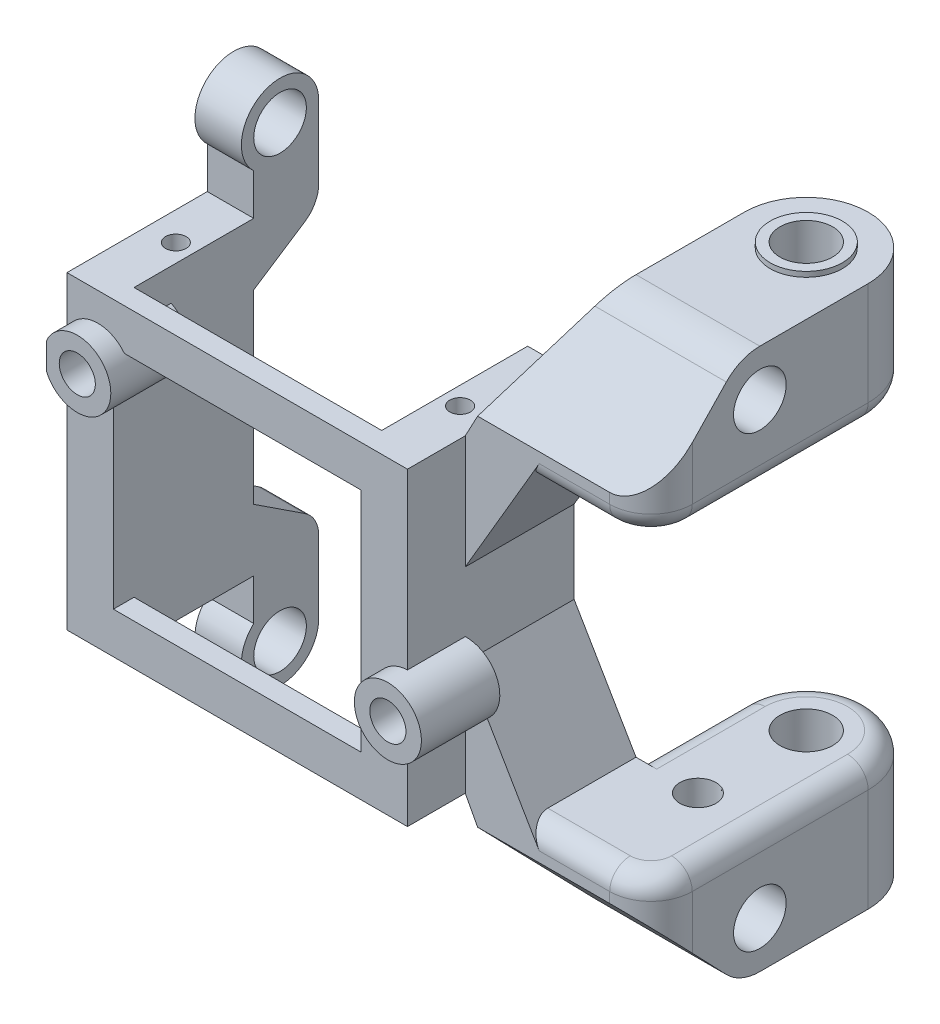
from build123d import *
from build123d.topology import SkipClean

# Parameters (mm, degrees)
BOSS_EXTRUDE1_DEPTH       = 12
BOSS_EXTRUDE2_DEPTH       = 8
BOSS_EXTRUDE3_START       = 11.25
SKETCH1_10_W              = 4.5
SKETCH1_10_H              = 13.6
SKETCH1_10_R              = 1
BOSS_EXTRUDE3_DEPTH       = 15
BOSS_EXTRUDE6_START       = 11.25
SKETCH1_14_W              = 24
SKETCH1_14_H              = 2
BOSS_EXTRUDE6_DEPTH       = 4
SKETCH3_R                 = 2.55
BOSS_EXTRUDE8_DEPTH       = 18
CUT_EXTRUDE2_DEPTH        = 18
BOSS_EXTRUDE12_DEPTH      = 2
BOSS_EXTRUDE12_DEPTH_BACK = 5.6
SKETCH4_R                 = 3.25
SKETCH4_R_2               = 1.75
SKETCH4_5_R               = 1.75
CUT_EXTRUDE3_DEPTH        = 4
SKETCH5_R                 = 3.75
SKETCH5_R_2               = 2.55
BOSS_EXTRUDE13_DEPTH      = 4.5
BOSS_EXTRUDE15_DEPTH      = 2.55
BOSS_EXTRUDE16_START      = -9
BOSS_EXTRUDE16_OUTLINE_R  = 2.55
BOSS_EXTRUDE16_DEPTH      = 52.5
CUT_EXTRUDE8_DEPTH        = 73.764500273
SKETCH3_4_R               = 2.55
CUT_EXTRUDE9_DEPTH        = 43.5
SKETCH11_R                = 3.5
SKETCH11_R_2              = 2.55
BOSS_EXTRUDE17_DEPTH      = 0.5
CUT_EXTRUDE10_DEPTH       = 67.553005191
CUT_EXTRUDE11_START       = -5.645461068
CUT_EXTRUDE11_DEPTH       = 39.790737469
FILLET1_R                 = 2


# Read off the part's stored shape, not the designer's step: Boss-Extrude16, Cut-Extrude11
with BuildPart() as part:
    # Sketch1 → Boss-Extrude1 (new body)
    with BuildSketch(Plane(origin=(0, 0, 0), x_dir=(1, 0, 0), z_dir=(0, 1, 0))):
        with BuildLine():
            Line((-4, -4), (0, -4))
            ThreePointArc((0, -4), (2.828427125, -2.828427125), (4, 0))
            Line((4, 0), (4, 4))
            Line((4, 4), (-4, 4))
            Line((-4, 4), (-4, -4))
        make_face()
    extrude(amount=BOSS_EXTRUDE1_DEPTH)

    # Sketch2 → Boss-Extrude2 (add)
    with BuildSketch(Plane.XY.offset(4)):
        Polygon((-14, 11.25), (-8, 0), (-4, 0), (-4, 12), (-8, 12), (-14, 22.25), align=None)
    extrude(amount=-BOSS_EXTRUDE2_DEPTH)

    # Sketch1<10> → Boss-Extrude3 (add)
    # profile 1 of 2: a face of its own
    with BuildSketch(Plane(origin=(0, 0, 0), x_dir=(1, 0, 0), z_dir=(0, 1, 0)).offset(BOSS_EXTRUDE3_START)):
        with Locations((-16.25, -2.8)):
            Rectangle(SKETCH1_10_W, SKETCH1_10_H)
        with Locations(Location((-16.75, -1.75, 0), (0, 0, 270))):
            Circle(SKETCH1_10_R, mode=Mode.SUBTRACT)
    # profile 2 of 2: a face of its own
    with BuildSketch(Plane(origin=(0, 0, 0), x_dir=(1, 0, 0), z_dir=(0, 1, 0)).offset(BOSS_EXTRUDE3_START)):
        with Locations((-44.75, -2.8)):
            Rectangle(SKETCH1_10_W, SKETCH1_10_H)
        with Locations(Location((-44.249954545, -1.8, 0), (0, 0, 270))):
            Circle(SKETCH1_10_R, mode=Mode.SUBTRACT)
    extrude(amount=BOSS_EXTRUDE3_DEPTH)


with BuildPart() as boss_extrude3_piece_1:
    # of the separate pieces the step leaves, piece 1, a body of its own (boss_extrude3_pieces)
    add(part.part.solids().sort_by_distance((0, 0, 4))[0])



with BuildPart() as boss_extrude3_piece_2:
    # of the separate pieces the step leaves, piece 2, a body of its own (boss_extrude3_pieces)
    add(part.part.solids().sort_by_distance((-42.5, 11.25, 9.6))[0])


with BuildPart() as boss_extrude3_piece_1_1:
    add(boss_extrude3_piece_1.part)

    add(boss_extrude3_piece_2.part)  # Boss-Extrude6 merges Boss-Extrude3 piece 2
    # Sketch1<14> → Boss-Extrude6 (add)
    with BuildSketch(Plane(origin=(0, 0, 0), x_dir=(1, 0, 0), z_dir=(0, 1, 0)).offset(BOSS_EXTRUDE6_START)):
        with Locations((-30.5, -8.6)):
            Rectangle(SKETCH1_14_W, SKETCH1_14_H)
    extrude(amount=BOSS_EXTRUDE6_DEPTH)

    # Sketch3 → Boss-Extrude8 (add)
    with BuildSketch(Plane(origin=(-14, 0, 0), x_dir=(0, 0, -1), z_dir=(1, 0, 0))):
        with BuildLine():
            Line((6.55, 9), (3.5, 9))
            Line((3.5, 9), (3.5, 1.191299349))
            ThreePointArc((3.5, 1.191299349), (10.741607862, 2.862800093), (6.55, 9))
        make_face()
        with Locations((6.55, 4.5)):
            Circle(SKETCH3_R, mode=Mode.SUBTRACT)
    extrude(amount=BOSS_EXTRUDE8_DEPTH)

    # Sketch2<5> → Cut-Extrude2 (cut)
    with BuildSketch(Plane.XY.offset(4)):
        Polygon((-14, 11.25), (-14, 0), (-8, 0), align=None)
    extrude(amount=-CUT_EXTRUDE2_DEPTH, mode=Mode.SUBTRACT)

    # Mirror1: Boss-Extrude3 piece 1 across plane


with BuildPart() as boss_extrude3_piece_1_2:
    add(boss_extrude3_piece_1_1.part)
    add(boss_extrude3_piece_1_1.part.mirror(Plane(origin=(0, 26.25, 0), x_dir=(0, 0, 1), z_dir=(0, -1, 0))))

    # Sketch4 → Boss-Extrude12 (add, two sides: drawn at the far end of the back side and taken through both)
    # profile 1 of 2: a face of its own
    with BuildSketch(Plane.XY.offset(9.6).offset(-BOSS_EXTRUDE12_DEPTH_BACK)):
        with Locations(Location((-13.9, 21.15, 0), (0, 0, 268.236774642))):
            Circle(SKETCH4_R)
        with Locations(Location((-13.9, 21.15, 0), (0, 0, 93.27582896))):
            Circle(SKETCH4_R_2, mode=Mode.SUBTRACT)
    # profile 2 of 2: a face of its own
    with BuildSketch(Plane.XY.offset(9.6).offset(-BOSS_EXTRUDE12_DEPTH_BACK)):
        with BuildLine():
            Line((-47, 36.5), (-47, 34))
            ThreePointArc((-47, 34), (-40.75, 35.25), (-47, 36.5))
        make_face()
        with Locations(Location((-44, 35.25, 0), (0, 0, 328.997280866))):
            Circle(SKETCH4_R_2, mode=Mode.SUBTRACT)
    extrude(amount=BOSS_EXTRUDE12_DEPTH + BOSS_EXTRUDE12_DEPTH_BACK)

    # Sketch4<5> → Cut-Extrude3 (cut)
    with BuildSketch(Plane.XY.offset(9.6)):
        with Locations(Location((-44, 35.25, 0), (0, 0, 328.997280866))):
            Circle(SKETCH4_5_R)
        with BuildLine():
            ThreePointArc((-14, 19.402859479), (-12.698438516, 19.877698935), (-12.15, 21.15))
            ThreePointArc((-12.15, 21.15), (-12.698438516, 22.422301065), (-14, 22.897140521))
            Line((-14, 22.897140521), (-14, 19.402859479))
        make_face()
        with BuildLine():
            Line((-14, 19.402859479), (-14, 22.897140521))
            ThreePointArc((-14, 22.897140521), (-15.65, 21.15), (-14, 19.402859479))
        make_face()
    extrude(amount=-CUT_EXTRUDE3_DEPTH, mode=Mode.SUBTRACT)

    # Sketch5 → Boss-Extrude13 (add)
    # profile 1 of 4: a face of its own
    with BuildSketch(Plane.ZY.offset(47)):
        with Locations((-6.55, 4.5)):
            Circle(SKETCH5_R)
        with Locations(Location((-6.55, 4.5, 0), (0, 0, 90))):
            Circle(SKETCH5_R_2, mode=Mode.SUBTRACT)
    # profile 2 of 4: a face of its own
    with BuildSketch(Plane.ZY.offset(47)):
        with BuildLine():
            Line((-4, 11.25), (-4, 17.25))
            Line((-4, 17.25), (-8.944573185, 14.009059393))
            ThreePointArc((-8.944573185, 14.009059393), (-9.939480967, 12.925882261), (-10.3, 11.5))
            Line((-10.3, 11.5), (-10.3, 4.5))
            ThreePointArc((-10.3, 4.5), (-8.05, 7.936931771), (-4, 7.249545417))
            Line((-4, 7.249545417), (-4, 11.25))
        make_face()
    # profile 3 of 4: a face of its own
    with BuildSketch(Plane.ZY.offset(47)):
        with BuildLine():
            Line((-4, 35.25), (-4, 41.25))
            Line((-4, 41.25), (-4, 45.250454583))
            ThreePointArc((-4, 45.250454583), (-8.05, 44.563068229), (-10.3, 48))
            Line((-10.3, 48), (-10.3, 41))
            ThreePointArc((-10.3, 41), (-9.939480967, 39.574117739), (-8.944573185, 38.490940607))
            Line((-8.944573185, 38.490940607), (-4, 35.25))
        make_face()
    # profile 4 of 4: a face of its own
    with BuildSketch(Plane.ZY.offset(47)):
        with Locations((-6.55, 48)):
            Circle(SKETCH5_R)
        with Locations(Location((-6.55, 48, 0), (0, 0, 270))):
            Circle(SKETCH5_R_2, mode=Mode.SUBTRACT)
    extrude(amount=-BOSS_EXTRUDE13_DEPTH)

    # Sketch9 → Boss-Extrude15 (add)
    with BuildSketch(Plane(origin=(0, 0, -4), x_dir=(-1, 0, 0), z_dir=(0, 0, -1))):
        Polygon((-4, 12), (-4, 9), (12.8, 9), (14, 11.25), (18.5, 11.25), (18.5, 41.25), (14, 41.25), (12.8, 43.5), (-4, 43.5), (-4, 40.5), (8, 40.5), (14, 30.25), (14, 22.25), (8, 12), align=None)
    extrude(amount=BOSS_EXTRUDE15_DEPTH)


with BuildPart() as body_2:
    # Boss-Extrude16 outline → Boss-Extrude16 (new body)
    with BuildSketch(Plane(origin=(0, 9, 0), x_dir=(1, 0, 0), z_dir=(0, 1, 0)).offset(BOSS_EXTRUDE16_START)):
        with BuildLine():
            Line((-8, 17.05), (-8, 6.55))
            Line((-8, 6.55), (4, 6.55))
            Line((4, 6.55), (4, 17.05))
            ThreePointArc((4, 17.05), (-2, 23.05), (-8, 17.05))
        make_face()
        with Locations((-2, 17.05)):
            Circle(BOSS_EXTRUDE16_OUTLINE_R, mode=Mode.SUBTRACT)
    extrude(amount=BOSS_EXTRUDE16_DEPTH)

    # Sketch10 → Cut-Extrude8 (cut, through all)
    with BuildSketch(Plane(origin=(0, 0, -6.55), x_dir=(-1, 0, 0), z_dir=(0, 0, -1))):
        Polygon((8, 40.5), (-4, 40.5), (-4, 12), (8, 12), (14, 22.25), (14, 30.25), align=None)
    extrude(amount=CUT_EXTRUDE8_DEPTH, mode=Mode.SUBTRACT)


with BuildPart() as cut_extrude8_piece_1:
    # of the separate pieces the step leaves, piece 1, a body of its own (cut_extrude8_pieces)
    add(body_2.part.solids().sort_by_distance((-8, 40.5, -6.55))[0])


with BuildPart() as cut_extrude8_piece_2:
    # of the separate pieces the step leaves, piece 2, a body of its own (cut_extrude8_pieces)
    add(body_2.part.solids().sort_by_distance((-8, 0, -17.05))[0])

    # Sketch3<4> → Cut-Extrude9 (cut)
    with BuildSketch(Plane(origin=(-14, 0, 0), x_dir=(0, 0, -1), z_dir=(1, 0, 0))):
        with Locations(Location((6.55, 4.5, 0), (0, 0, 90))):
            Circle(SKETCH3_4_R)
    cut_extrude9 = extrude(amount=CUT_EXTRUDE9_DEPTH, mode=Mode.SUBTRACT)


with BuildPart() as cut_extrude8_piece_1_1:
    add(cut_extrude8_piece_1.part)

    # Mirror10: Cut-Extrude9 across plane
    add(cut_extrude9.mirror(Plane.ZX.offset(26.25)), mode=Mode.SUBTRACT)

    # Combine1: union Boss-Extrude3 piece 1, Cut-Extrude8 piece 2
    add(boss_extrude3_piece_1_2.part)
    add(cut_extrude8_piece_2.part)

    # Sketch11 → Boss-Extrude17 (add)
    with BuildSketch(Plane(origin=(0, 52.5, 0), x_dir=(1, 0, 0), z_dir=(0, 1, 0))):
        with Locations(Location((-2, 17.05, 0), (0, 0, 90))):
            Circle(SKETCH11_R)
        with Locations(Location((-2, 17.05, 0), (0, 0, 270))):
            Circle(SKETCH11_R_2, mode=Mode.SUBTRACT)
    boss_extrude17 = extrude(amount=BOSS_EXTRUDE17_DEPTH)

    # Mirror11: Boss-Extrude17 across plane
    with SkipClean():  # the faces are left unmerged after this step: merging them gives an invalid solid
        add(boss_extrude17.mirror(Plane.ZX.offset(26.25)))

    # Sketch3<6> → Cut-Extrude10 (cut, through all)
    with SkipClean():  # the faces are left unmerged after this step: merging them gives an invalid solid
        with BuildSketch(Plane(origin=(-14, 0, 0), x_dir=(0, 0, -1), z_dir=(1, 0, 0))):
            with BuildLine():
                ThreePointArc((3.5, 1.191299349), (3.399533738, 1.286814302), (3.302057163, 1.385378461))
                Line((3.302057163, 1.385378461), (-4, 9))
                Line((-4, 9), (-4, 0))
                Line((-4, 0), (3.5, 0))
                Line((3.5, 0), (3.5, 1.191299349))
            make_face()
            with BuildLine():
                ThreePointArc((6.55, 0), (4.912800093, 0.308392138), (3.5, 1.191299349))
                Line((3.5, 1.191299349), (3.5, 0))
                Line((3.5, 0), (6.55, 0))
            make_face()
        cut_extrude10 = extrude(amount=CUT_EXTRUDE10_DEPTH, mode=Mode.SUBTRACT)

    # Mirror12: Cut-Extrude10 across plane
    with SkipClean():  # the faces are left unmerged after this step: merging them gives an invalid solid
        add(cut_extrude10.mirror(Plane.ZX.offset(26.25)), mode=Mode.SUBTRACT)

    # Cut-Extrude11 outline → Cut-Extrude11 (cut)
    with SkipClean():  # the faces are left unmerged after this step: merging them gives an invalid solid
        with BuildSketch(Plane.XZ.offset(-40.5).offset(CUT_EXTRUDE11_START)):
            with BuildLine():
                add(Edge.make_bspline(
                    [(-2, -8.3), (-2.48070202, -8.3), (-2.918032209, -8.103950187), (-3.545461697, -7.482251288), (-3.748843358, -7.031299204), (-3.751146446, -6.077148922), (-3.550405736, -5.624496749), (-2.920377961, -4.996546228), (-2.476175801, -4.80105121), (-1.531582409, -4.798957389), (-1.083765933, -4.994610712), (-0.454105024, -5.617836158), (-0.251120076, -6.072360765), (-0.248889631, -7.019396107), (-0.452928492, -7.479716595), (-1.079836764, -8.102772623), (-1.51929798, -8.3), (-2, -8.3)],
                    knots=[0, 0, 0, 0, 0.125, 0.125, 0.25, 0.25, 0.375, 0.375, 0.5, 0.5, 0.625, 0.625, 0.75, 0.75, 0.875, 0.875, 1, 1, 1, 1], degree=3))
            make_face()
        extrude(amount=CUT_EXTRUDE11_DEPTH, mode=Mode.SUBTRACT)

    # Fillet1
    fillet1_edges = [cut_extrude8_piece_1_1.edges().sort_by_distance(p)[0] for p in [
        (-2, 40.5, -23.05),
        (-8, 40.5, -11.8),
        (4, 40.5, -8.525),
        (-4, 12, 4),
        (2.828427125, 12, 2.828427125),
        (4, 12, -8.525),
        (-8, 12, -11.8),
        (2.828427125, 40.5, 2.828427125),
        (-4, 40.5, 4),
        (-2, 12, -23.05),
    ]]
    fillet(fillet1_edges, radius=FILLET1_R)


solid = cut_extrude8_piece_1_1.part
